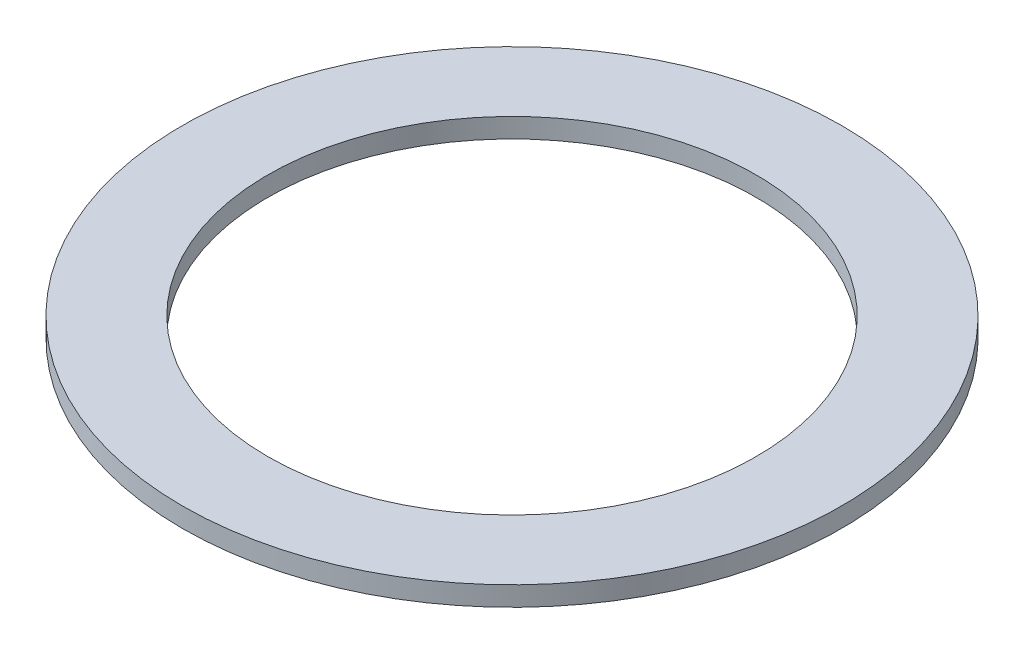
from build123d import *

# Parameters (mm, degrees)
SKETCH1_R           = 67.5
BOSS_EXTRUDE1_DEPTH = 4
SKETCH2_R           = 50
CUT_EXTRUDE1_DEPTH  = 96.543183954


with BuildPart() as part:
    # Sketch1 → Boss-Extrude1 (new body)
    with BuildSketch(Plane(origin=(0, 0, 0), x_dir=(1, 0, 0), z_dir=(0, 1, 0))):
        Circle(SKETCH1_R)
    extrude(amount=BOSS_EXTRUDE1_DEPTH)

    # Sketch2 → Cut-Extrude1 (cut, through all)
    with BuildSketch(Plane(origin=(0, 0, 0), x_dir=(1, 0, 0), z_dir=(0, 1, 0))):
        Circle(SKETCH2_R)
    extrude(amount=CUT_EXTRUDE1_DEPTH, mode=Mode.SUBTRACT)


solid = part.part
